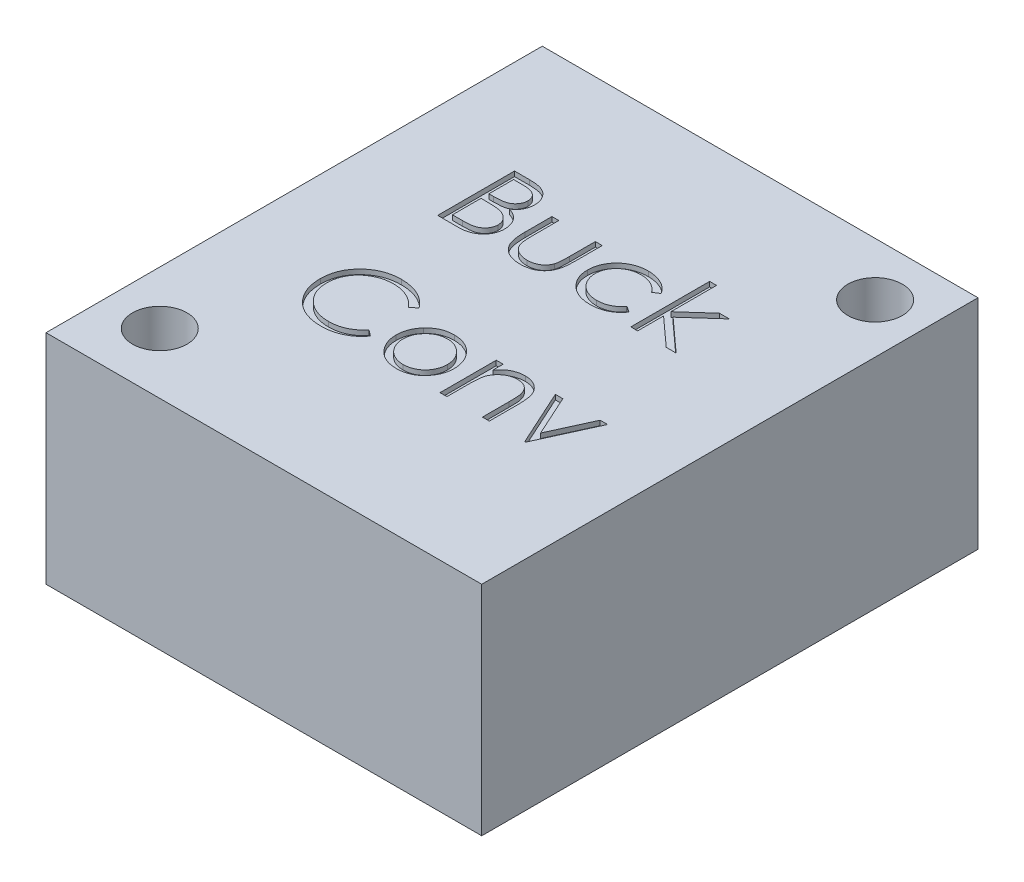
from build123d import *

# Parameters (mm, degrees)
SKETCH1_W           = 18
SKETCH1_H           = 20.5
SKETCH1_R           = 1.125
BOSS_EXTRUDE1_DEPTH = 9
CUT_EXTRUDE1_DEPTH  = 0.2


with BuildPart() as part:
    # Sketch1 → Boss-Extrude1 (new body)
    with BuildSketch(Plane(origin=(0, 0, 0), x_dir=(1, 0, 0), z_dir=(0, 1, 0))):
        Rectangle(SKETCH1_W, SKETCH1_H)
        with Locations((6.95, 8.05)):
            Circle(SKETCH1_R, mode=Mode.SUBTRACT)
        with Locations((-6.8, -7.75)):
            Circle(SKETCH1_R, mode=Mode.SUBTRACT)
    extrude(amount=BOSS_EXTRUDE1_DEPTH)

    # Sketch3 → Cut-Extrude1 (cut)
    # profile 1 of 8: a face of its own
    with BuildSketch(Plane(origin=(0, 9, 0), x_dir=(1, 0, 0), z_dir=(0, 1, 0))):
        with BuildLine():
            Line((-5.106587344, 5.210805031), (-4.487106175, 5.210805031))
            add(Edge.make_bspline(
                [(-4.487106175, 5.210805031), (-4.456781769, 5.210645601), (-4.398005525, 5.210336584), (-4.312535031, 5.20554403), (-4.232480753, 5.199009272), (-4.157819474, 5.188640545), (-4.088585694, 5.176129433), (-4.024570766, 5.1609785), (-3.965978252, 5.1428115), (-3.896025984, 5.113922374), (-3.816269385, 5.070993499), (-3.729910843, 5.007558301), (-3.656065569, 4.929968138), (-3.592396552, 4.842444586), (-3.541776965, 4.746164279), (-3.505156245, 4.643422015), (-3.481971601, 4.535543006), (-3.479587236, 4.461480981), (-3.478382216, 4.424051225)],
                knots=[0, 0, 0, 0, 1.001505555, 1.941167018, 2.826882275, 3.653841531, 4.429895133, 5.150066043, 5.825578002, 6.45369114, 7.647487171, 8.808567382, 9.977351308, 11.170798116, 12.373658725, 13.556498008, 14.765093433, 16, 16, 16, 16], degree=3))
            add(Edge.make_bspline(
                [(-3.478382216, 4.424051225), (-3.479373922, 4.388987835), (-3.481322716, 4.320084968), (-3.499957933, 4.21930674), (-3.529132254, 4.123375277), (-3.569686301, 4.032640685), (-3.622393112, 3.94915305), (-3.684857444, 3.872238887), (-3.760219972, 3.805154714), (-3.816683483, 3.767650795), (-3.845364388, 3.748600504)],
                knots=[0, 0, 0, 0, 1.044552857, 2.05264487, 3.044412934, 4.028983338, 5.005914585, 5.980388656, 6.974128949, 8, 8, 8, 8], degree=3))
            add(Edge.make_bspline(
                [(-3.845364388, 3.748600504), (-3.809296, 3.734752969), (-3.740288239, 3.708259205), (-3.645323071, 3.661418463), (-3.563503461, 3.610471405), (-3.494200336, 3.554834656), (-3.434929749, 3.49486452), (-3.383174581, 3.429681667), (-3.33901362, 3.358435793), (-3.301174039, 3.281869729), (-3.271647667, 3.20076529), (-3.24953524, 3.115883229), (-3.236864768, 3.027527918), (-3.235061694, 2.96739761), (-3.234151447, 2.93704201)],
                knots=[0, 0, 0, 0, 1.27268992, 2.434971085, 3.483601985, 4.442670788, 5.356604649, 6.2567628, 7.179492994, 8.113709626, 9.066344395, 10.018646069, 10.999752585, 12, 12, 12, 12], degree=3))
            add(Edge.make_bspline(
                [(-3.234151447, 2.93704201), (-3.235037586, 2.906047776), (-3.236781089, 2.845065753), (-3.249644349, 2.755480738), (-3.271424039, 2.669869179), (-3.301424293, 2.587677335), (-3.340578679, 2.509064213), (-3.388229046, 2.433940752), (-3.445044822, 2.363061752), (-3.508601853, 2.295639608), (-3.580503942, 2.235017258), (-3.658078948, 2.18102801), (-3.742303824, 2.136626939), (-3.831795276, 2.099328834), (-3.927557191, 2.070838018), (-4.029159557, 2.050905755), (-4.136514745, 2.037475471), (-4.21018359, 2.036371293), (-4.247963546, 2.035805031)],
                knots=[0, 0, 0, 0, 0.978564426, 1.925352924, 2.850884081, 3.763762016, 4.682927383, 5.618979971, 6.567305752, 7.547517671, 8.540179244, 9.531824382, 10.526200242, 11.540722885, 12.589160233, 13.674978461, 14.80764778, 16, 16, 16, 16], degree=3))
            Line((-4.247963546, 2.035805031), (-5.106587344, 2.035805031))
            Line((-5.106587344, 2.035805031), (-5.106587344, 5.210805031))
        make_face()
        with BuildLine():
            Line((-4.821651447, 4.885164006), (-4.821651447, 3.867535801))
            Line((-4.821651447, 3.867535801), (-4.630210141, 3.867535801))
            add(Edge.make_bspline(
                [(-4.630210141, 3.867535801), (-4.602225877, 3.867898588), (-4.548154575, 3.868599567), (-4.469850097, 3.870607543), (-4.397165259, 3.876230054), (-4.330225525, 3.881850949), (-4.269136308, 3.890990039), (-4.214032948, 3.901868608), (-4.164050649, 3.913373814), (-4.106411205, 3.93294042), (-4.041030744, 3.961858026), (-3.971332142, 4.006736048), (-3.909887302, 4.060188855), (-3.858001282, 4.12186637), (-3.815536591, 4.189780696), (-3.786042006, 4.262848223), (-3.76604197, 4.339247914), (-3.764235367, 4.391697329), (-3.763318114, 4.418327067)],
                knots=[0, 0, 0, 0, 1.156816544, 2.235205308, 3.236616184, 4.169592532, 5.011045266, 5.787822928, 6.49130361, 7.128639758, 8.301311294, 9.436451833, 10.541879658, 11.654887649, 12.756523258, 13.837046038, 14.901820046, 16, 16, 16, 16], degree=3))
            add(Edge.make_bspline(
                [(-3.763318114, 4.418327067), (-3.763795434, 4.435949016), (-3.764731751, 4.470516395), (-3.772400104, 4.520907595), (-3.785433546, 4.568300142), (-3.802174227, 4.613343514), (-3.825568251, 4.654629264), (-3.85311225, 4.693584877), (-3.886391412, 4.728883727), (-3.92427126, 4.761876058), (-3.967821939, 4.791126451), (-4.017017468, 4.816744857), (-4.072523433, 4.837373991), (-4.13340438, 4.855440786), (-4.200597438, 4.868130167), (-4.273327211, 4.878701454), (-4.35218942, 4.884083299), (-4.406749621, 4.884795735), (-4.434952729, 4.885164006)],
                knots=[0, 0, 0, 0, 0.91205012, 1.789085906, 2.630437955, 3.453916878, 4.269457761, 5.079663411, 5.91843418, 6.774407191, 7.675494373, 8.627863946, 9.638891023, 10.736472738, 11.911756761, 13.175263542, 14.539845004, 16, 16, 16, 16], degree=3))
            Line((-4.434952729, 4.885164006), (-4.821651447, 4.885164006))
        make_face(mode=Mode.SUBTRACT)
        with BuildLine():
            Line((-4.821651447, 3.541894775), (-4.821651447, 2.361446057))
            Line((-4.821651447, 2.361446057), (-4.4158722, 2.361446057))
            add(Edge.make_bspline(
                [(-4.4158722, 2.361446057), (-4.38682646, 2.361794171), (-4.330844626, 2.362465114), (-4.250017081, 2.36465546), (-4.175102409, 2.369637739), (-4.106442457, 2.377480759), (-4.043295832, 2.385988352), (-3.986420058, 2.397428586), (-3.93535409, 2.410535857), (-3.876140968, 2.430796142), (-3.809462786, 2.462270798), (-3.737607223, 2.509727275), (-3.673720582, 2.566263418), (-3.619468669, 2.631696462), (-3.575006886, 2.70284488), (-3.542662295, 2.77826959), (-3.522713446, 2.856724318), (-3.520298478, 2.910215551), (-3.519087344, 2.93704201)],
                knots=[0, 0, 0, 0, 1.160039823, 2.235823828, 3.228722157, 4.157150951, 4.99529583, 5.772374946, 6.472645482, 7.099169577, 8.269452708, 9.405989375, 10.527446681, 11.663510218, 12.788923519, 13.866172445, 14.929861265, 16, 16, 16, 16], degree=3))
            add(Edge.make_bspline(
                [(-3.519087344, 2.93704201), (-3.519337811, 2.953818112), (-3.519834703, 2.987099716), (-3.52732826, 3.036009066), (-3.538226557, 3.083385394), (-3.552315786, 3.129357344), (-3.572834874, 3.173093764), (-3.596789383, 3.215459657), (-3.624875797, 3.256511028), (-3.668640147, 3.308410715), (-3.732296162, 3.368206863), (-3.822744451, 3.426751597), (-3.925589321, 3.473966393), (-4.000181404, 3.494013775), (-4.038713747, 3.504369735)],
                knots=[0, 0, 0, 0, 0.723448775, 1.435228256, 2.130040452, 2.821711965, 3.505591119, 4.210454504, 4.921174351, 5.648778258, 7.137944449, 8.670945889, 10.280296675, 12, 12, 12, 12], degree=3))
            add(Edge.make_bspline(
                [(-4.038713747, 3.504369735), (-4.054161569, 3.50750399), (-4.087655635, 3.5142997), (-4.142272512, 3.521473117), (-4.204625764, 3.527863993), (-4.274859374, 3.532591257), (-4.353062202, 3.537477622), (-4.439401264, 3.539377924), (-4.53352397, 3.54164511), (-4.598831337, 3.541809424), (-4.632754211, 3.541894775)],
                knots=[0, 0, 0, 0, 0.634451884, 1.375622551, 2.216452059, 3.157844607, 4.20941857, 5.370758133, 6.634282058, 8, 8, 8, 8], degree=3))
            Line((-4.632754211, 3.541894775), (-4.821651447, 3.541894775))
        make_face(mode=Mode.SUBTRACT)
    # profile 2 of 8: a face of its own
    with BuildSketch(Plane(origin=(0, 9, 0), x_dir=(1, 0, 0), z_dir=(0, 1, 0))):
        with BuildLine():
            Line((-2.70498478, 4.355997339), (-2.420048883, 4.355997339))
            Line((-2.420048883, 4.355997339), (-2.420048883, 3.279855512))
            add(Edge.make_bspline(
                [(-2.420048883, 3.279855512), (-2.419920155, 3.248266304), (-2.419673904, 3.187837628), (-2.418003908, 3.10088328), (-2.414075894, 3.021583834), (-2.409164782, 2.94989348), (-2.40284913, 2.885824346), (-2.395334939, 2.829600215), (-2.386936228, 2.780583491), (-2.378715051, 2.751062018), (-2.374891631, 2.737332475)],
                knots=[0, 0, 0, 0, 1.388932606, 2.656963016, 3.823490214, 4.879454478, 5.816252168, 6.653371382, 7.373723809, 8, 8, 8, 8], degree=3))
            add(Edge.make_bspline(
                [(-2.374891631, 2.737332475), (-2.368758026, 2.720076014), (-2.356618331, 2.685921848), (-2.334598813, 2.636583251), (-2.307358822, 2.590885673), (-2.277550264, 2.547066979), (-2.243170087, 2.506425176), (-2.204653281, 2.469028898), (-2.163289166, 2.433465187), (-2.101825681, 2.391387554), (-2.017770489, 2.346288647), (-1.907414061, 2.307376012), (-1.787758085, 2.284120661), (-1.705058661, 2.281422587), (-1.662551888, 2.280035801)],
                knots=[0, 0, 0, 0, 0.725840625, 1.436591201, 2.137033971, 2.831655856, 3.53531722, 4.242432219, 4.957935707, 5.694543706, 7.190802206, 8.724350549, 10.316345118, 12, 12, 12, 12], degree=3))
            add(Edge.make_bspline(
                [(-1.662551888, 2.280035801), (-1.620049063, 2.281452076), (-1.537813961, 2.284192307), (-1.419472667, 2.306674517), (-1.311294599, 2.344235392), (-1.214365521, 2.396674973), (-1.129125081, 2.46084813), (-1.058091786, 2.536148978), (-0.999483777, 2.620195207), (-0.973893802, 2.682900803), (-0.961024444, 2.714435841)],
                knots=[0, 0, 0, 0, 1.157059328, 2.238695713, 3.266970494, 4.264342957, 5.228770407, 6.160125903, 7.074715775, 8, 8, 8, 8], degree=3))
            add(Edge.make_bspline(
                [(-0.961024444, 2.714435841), (-0.957219678, 2.727105269), (-0.94880827, 2.75511428), (-0.939770994, 2.802630195), (-0.931629875, 2.859294514), (-0.92467828, 2.925478032), (-0.919720596, 3.001007792), (-0.917048129, 3.08586019), (-0.914028908, 3.179768852), (-0.913983083, 3.245507462), (-0.913959139, 3.279855512)],
                knots=[0, 0, 0, 0, 0.557542046, 1.232589297, 2.036731608, 2.971723315, 4.038036528, 5.22795436, 6.551621927, 8, 8, 8, 8], degree=3))
            Line((-0.913959139, 3.279855512), (-0.913959139, 4.355997339))
            Line((-0.913959139, 4.355997339), (-0.629023242, 4.355997339))
            Line((-0.629023242, 4.355997339), (-0.629023242, 3.226430031))
            add(Edge.make_bspline(
                [(-0.629023242, 3.226430031), (-0.629423922, 3.188051383), (-0.630201297, 3.113591555), (-0.635197244, 3.005383825), (-0.643769393, 2.904543789), (-0.656780257, 2.811018068), (-0.672079833, 2.724878067), (-0.691815881, 2.646013384), (-0.715381854, 2.574667003), (-0.741966142, 2.509586962), (-0.773373122, 2.450580137), (-0.806780491, 2.394576932), (-0.845356534, 2.342966912), (-0.885969532, 2.293180973), (-0.931146748, 2.247695445), (-0.98004162, 2.205466606), (-1.031965951, 2.165848927), (-1.088072009, 2.130387552), (-1.147540724, 2.098441024), (-1.210445508, 2.070123582), (-1.277556842, 2.047714815), (-1.348008856, 2.028382997), (-1.42214672, 2.013220586), (-1.499898962, 2.002528486), (-1.581239393, 1.995974079), (-1.636674402, 1.995396188), (-1.665095958, 1.995099903)],
                knots=[0, 0, 0, 0, 1.493040784, 2.896703357, 4.213163133, 5.428574705, 6.569057535, 7.615249723, 8.588095153, 9.490268104, 10.346124644, 11.18633936, 12.024365274, 12.850166724, 13.684164916, 14.514361689, 15.362232829, 16.222528818, 17.093394965, 17.986930858, 18.902426812, 19.842810585, 20.827885679, 21.843828298, 22.894529745, 24, 24, 24, 24], degree=3))
            add(Edge.make_bspline(
                [(-1.665095958, 1.995099903), (-1.693304939, 1.995408066), (-1.748738212, 1.996013635), (-1.830082841, 2.002492275), (-1.908050505, 2.013203972), (-1.982364009, 2.028494062), (-2.053097927, 2.047579504), (-2.120538773, 2.070261283), (-2.183896862, 2.09845572), (-2.243933395, 2.130185361), (-2.300178418, 2.166076718), (-2.3528912, 2.205417726), (-2.402001059, 2.248149654), (-2.447518828, 2.294094043), (-2.488805599, 2.343820835), (-2.526375866, 2.396930022), (-2.56080802, 2.452895374), (-2.591970908, 2.5128241), (-2.618742286, 2.57865728), (-2.642378116, 2.651498218), (-2.66170991, 2.732145501), (-2.677442006, 2.820530179), (-2.690097956, 2.916229252), (-2.69888467, 3.019796315), (-2.703797603, 3.130979093), (-2.704580523, 3.207768636), (-2.70498478, 3.247418613)],
                knots=[0, 0, 0, 0, 1.083640291, 2.129454052, 3.13281866, 4.105697902, 5.042300162, 5.946461698, 6.836384745, 7.703652036, 8.553297018, 9.397182691, 10.228592656, 11.052265423, 11.879314572, 12.708807002, 13.549817954, 14.402308542, 15.300838682, 16.27712199, 17.341985831, 18.484375296, 19.725102775, 21.0496083, 22.476576903, 24, 24, 24, 24], degree=3))
            Line((-2.70498478, 3.247418613), (-2.70498478, 4.355997339))
        make_face()
    # profile 3 of 8: a face of its own
    with BuildSketch(Plane(origin=(0, 9, 0), x_dir=(1, 0, 0), z_dir=(0, 1, 0))):
        with BuildLine():
            Line((2.301745989, 3.852907395), (2.063239378, 3.704715288))
            add(Edge.make_bspline(
                [(2.063239378, 3.704715288), (2.037086572, 3.737216759), (1.985609213, 3.801190388), (1.896220048, 3.883749399), (1.800959694, 3.954658072), (1.698200322, 4.012446475), (1.588086061, 4.057097362), (1.47105116, 4.088693334), (1.347112309, 4.108382183), (1.262144593, 4.110619957), (1.218607968, 4.11176657)],
                knots=[0, 0, 0, 0, 1.026593902, 2.0206758, 2.988051866, 3.946915611, 4.916868779, 5.907761954, 6.927957743, 8, 8, 8, 8], degree=3))
            add(Edge.make_bspline(
                [(1.218607968, 4.11176657), (1.183810914, 4.110807863), (1.115279063, 4.108919716), (1.014671338, 4.09711734), (0.918838632, 4.075670661), (0.827180275, 4.047412293), (0.740348181, 4.009538816), (0.658114848, 3.963447108), (0.579750867, 3.909880286), (0.507527109, 3.847822148), (0.441460796, 3.780331928), (0.384221066, 3.707983933), (0.33438542, 3.632945175), (0.295282159, 3.553341809), (0.263282541, 3.47099496), (0.24223073, 3.384350248), (0.228202042, 3.294517699), (0.226597008, 3.233268919), (0.22578445, 3.202261361)],
                knots=[0, 0, 0, 0, 1.112346261, 2.190735716, 3.231507886, 4.247384806, 5.251966152, 6.253067467, 7.256802811, 8.280671706, 9.291813951, 10.270744147, 11.225547591, 12.165006084, 13.100104208, 14.043489273, 15.009504848, 16, 16, 16, 16], degree=3))
            add(Edge.make_bspline(
                [(0.22578445, 3.202261361), (0.227398486, 3.161649291), (0.23060481, 3.080972364), (0.255733992, 2.961884372), (0.296867847, 2.846746452), (0.353163183, 2.736376071), (0.424353155, 2.634237087), (0.507966837, 2.542630668), (0.604050577, 2.463331842), (0.711757763, 2.397588909), (0.82855943, 2.344737525), (0.953191882, 2.307084445), (1.084636683, 2.284358364), (1.174631375, 2.281495473), (1.220516021, 2.280035801)],
                knots=[0, 0, 0, 0, 0.966302908, 1.919585723, 2.883856336, 3.870342332, 4.860282998, 5.839159637, 6.814385684, 7.815993281, 8.834850808, 9.858348828, 10.908058873, 12, 12, 12, 12], degree=3))
            add(Edge.make_bspline(
                [(1.220516021, 2.280035801), (1.262566795, 2.28121463), (1.345207726, 2.283531343), (1.466009477, 2.303061188), (1.581016968, 2.335032199), (1.69022611, 2.379616139), (1.793437346, 2.437244671), (1.889983812, 2.508327633), (1.981786613, 2.59082012), (2.035758871, 2.654608566), (2.063239378, 2.687087083)],
                knots=[0, 0, 0, 0, 1.039848629, 2.043578496, 3.018386758, 3.987534228, 4.954977003, 5.934852016, 6.948509513, 8, 8, 8, 8], degree=3))
            Line((2.063239378, 2.687087083), (2.301745989, 2.530626746))
            add(Edge.make_bspline(
                [(2.301745989, 2.530626746), (2.287605716, 2.509861587), (2.259372104, 2.46840019), (2.212175615, 2.40994017), (2.161266911, 2.355219787), (2.106844601, 2.30431239), (2.0496193, 2.255999758), (1.987636125, 2.212591544), (1.922893691, 2.171647812), (1.854631955, 2.134806135), (1.783556679, 2.101689686), (1.709767874, 2.07321341), (1.633586187, 2.048747671), (1.554922046, 2.029300935), (1.473620367, 2.01377896), (1.389891413, 2.003479531), (1.303764021, 1.99579124), (1.245550712, 1.995332347), (1.216063898, 1.995099903)],
                knots=[0, 0, 0, 0, 0.954134338, 1.905101784, 2.851144739, 3.791306361, 4.734911809, 5.6936923, 6.663572882, 7.643865596, 8.638447847, 9.640600242, 10.646758161, 11.676244097, 12.717260333, 13.78922464, 14.880174919, 16, 16, 16, 16], degree=3))
            add(Edge.make_bspline(
                [(1.216063898, 1.995099903), (1.171059739, 1.995908421), (1.082851261, 1.997493123), (0.953744415, 2.014917954), (0.830360588, 2.041186649), (0.712741935, 2.078890893), (0.600870144, 2.127427368), (0.494849529, 2.186715426), (0.395031141, 2.257247407), (0.302402074, 2.337767919), (0.217328905, 2.425071929), (0.144280147, 2.51927864), (0.080920508, 2.616924448), (0.030041094, 2.720165947), (-0.010460046, 2.827630963), (-0.038132287, 2.940180395), (-0.056029978, 3.056886368), (-0.058101329, 3.136472626), (-0.059151447, 3.176820656)],
                knots=[0, 0, 0, 0, 1.1129367, 2.181364009, 3.217532258, 4.231199276, 5.232079859, 6.230262199, 7.231623845, 8.250719726, 9.263571943, 10.242672461, 11.195837495, 12.138959767, 13.085126421, 14.0317438, 15.002148558, 16, 16, 16, 16], degree=3))
            add(Edge.make_bspline(
                [(-0.059151447, 3.176820656), (-0.058751382, 3.204196808), (-0.057955588, 3.258652491), (-0.048827982, 3.339474445), (-0.03703651, 3.419220054), (-0.01705602, 3.496878485), (0.006022267, 3.573627569), (0.035482214, 3.64854224), (0.070040179, 3.721970621), (0.109275874, 3.793723562), (0.153443522, 3.862620644), (0.202321498, 3.927711468), (0.25406886, 3.98977797), (0.311106476, 4.046677381), (0.371013876, 4.100685212), (0.435485948, 4.150358654), (0.504152899, 4.195843695), (0.575983485, 4.237981402), (0.650935902, 4.275500318), (0.728557095, 4.307824756), (0.808379343, 4.335449592), (0.890530331, 4.357319826), (0.974464788, 4.375659917), (1.060844145, 4.387196821), (1.149337947, 4.395348654), (1.209260196, 4.396247444), (1.23959655, 4.396702467)],
                knots=[0, 0, 0, 0, 0.990994727, 1.971252077, 2.943264845, 3.907940874, 4.872158414, 5.844625996, 6.82015047, 7.809835459, 8.804511986, 9.781214284, 10.756496977, 11.728388426, 12.696359165, 13.676225489, 14.672885716, 15.677705647, 16.690706858, 17.706033469, 18.721040654, 19.747369689, 20.783475414, 21.830280724, 22.901553713, 24, 24, 24, 24], degree=3))
            add(Edge.make_bspline(
                [(1.23959655, 4.396702467), (1.277587791, 4.39586618), (1.353380374, 4.394197787), (1.465812301, 4.380156438), (1.576588227, 4.358986974), (1.683764528, 4.327624479), (1.786041723, 4.289648163), (1.881777453, 4.247000915), (1.968718119, 4.19747581), (2.048481003, 4.143301135), (2.12121528, 4.08219517), (2.187667569, 4.01342743), (2.249200565, 3.93735581), (2.284086296, 3.881289182), (2.301745989, 3.852907395)],
                knots=[0, 0, 0, 0, 1.095225653, 2.184976855, 3.262915854, 4.344593502, 5.400796181, 6.407717688, 7.363229445, 8.282371371, 9.184954523, 10.097238608, 11.036792983, 12, 12, 12, 12], degree=3))
        make_face()
    # profile 4 of 8: a face of its own
    with BuildSketch(Plane(origin=(0, 9, 0), x_dir=(1, 0, 0), z_dir=(0, 1, 0))):
        Polygon((2.871617784, 5.292215288), (3.156553681, 5.292215288), (3.156553681, 3.409603108), (4.212342944, 4.355997339), (4.621938297, 4.355997339), (3.396968345, 3.256958877), (4.744053681, 2.035805031), (4.335094346, 2.035805031), (3.156553681, 3.104950664), (3.156553681, 2.035805031), (2.871617784, 2.035805031), align=None)
    # profile 5 of 8: a face of its own
    with BuildSketch(Plane(origin=(0, 9, 0), x_dir=(1, 0, 0), z_dir=(0, 1, 0))):
        with BuildLine():
            Line((-2.175818114, -1.663453783), (-2.425137024, -1.854259071))
            add(Edge.make_bspline(
                [(-2.425137024, -1.854259071), (-2.442922366, -1.833062799), (-2.478253264, -1.790956025), (-2.535094112, -1.731828867), (-2.594332031, -1.676433951), (-2.655944376, -1.624507389), (-2.721040149, -1.577865037), (-2.788042445, -1.534076251), (-2.8580721, -1.494826231), (-2.954911174, -1.447234808), (-3.081591722, -1.397572225), (-3.241062754, -1.355931436), (-3.407533537, -1.329423656), (-3.521105645, -1.326552692), (-3.578873002, -1.325092405)],
                knots=[0, 0, 0, 0, 0.757959112, 1.505699292, 2.245454638, 2.979532153, 3.711538275, 4.438200793, 5.171680507, 5.909471876, 7.393775596, 8.890124382, 10.418191784, 12, 12, 12, 12], degree=3))
            add(Edge.make_bspline(
                [(-3.578873002, -1.325092405), (-3.610698566, -1.325458856), (-3.674054323, -1.326188359), (-3.768078296, -1.335812351), (-3.860346564, -1.349338949), (-3.950799108, -1.369409777), (-4.039320792, -1.394784939), (-4.126490328, -1.425106565), (-4.211045658, -1.462621312), (-4.294156488, -1.504085234), (-4.373784772, -1.550918701), (-4.449127566, -1.602002956), (-4.51991008, -1.656766351), (-4.586188306, -1.71541414), (-4.648030002, -1.777682204), (-4.704987063, -1.844234143), (-4.756862399, -1.914857186), (-4.804684272, -1.988620063), (-4.847512966, -2.065307917), (-4.883372214, -2.145204588), (-4.91512686, -2.226941881), (-4.94025403, -2.311443291), (-4.960142699, -2.398114229), (-4.973865651, -2.487187301), (-4.983380192, -2.578476425), (-4.984106067, -2.640352015), (-4.98447196, -2.671541723)],
                knots=[0, 0, 0, 0, 1.054917814, 2.100044995, 3.131103042, 4.146048494, 5.169673617, 6.183595914, 7.203665975, 8.234915748, 9.262203917, 10.264457458, 11.251630812, 12.227803204, 13.197192746, 14.159520551, 15.12972552, 16.100847026, 17.073214652, 18.039054194, 19.002613845, 19.979014051, 20.95965708, 21.949030935, 22.966165397, 24, 24, 24, 24], degree=3))
            add(Edge.make_bspline(
                [(-4.98447196, -2.671541723), (-4.98332731, -2.718469421), (-4.981079941, -2.81060573), (-4.961078952, -2.945561927), (-4.930685048, -3.074848538), (-4.885132346, -3.197657395), (-4.828962922, -3.315502834), (-4.75798751, -3.426390937), (-4.675785365, -3.531997392), (-4.58119357, -3.629826351), (-4.477411152, -3.719192374), (-4.36606126, -3.797887544), (-4.247421228, -3.863487473), (-4.122800999, -3.918075653), (-3.991241596, -3.960037113), (-3.852979596, -3.989577425), (-3.708315715, -4.008847118), (-3.609464902, -4.010691963), (-3.559156455, -4.011630866)],
                knots=[0, 0, 0, 0, 1.029171465, 2.020641659, 2.987623507, 3.938342917, 4.889210282, 5.84687017, 6.821220943, 7.821438502, 8.827599549, 9.822697543, 10.807740252, 11.797342354, 12.80366471, 13.83203677, 14.896651826, 16, 16, 16, 16], degree=3))
            add(Edge.make_bspline(
                [(-3.559156455, -4.011630866), (-3.503727587, -4.010098902), (-3.394630315, -4.007083629), (-3.23463932, -3.981539167), (-3.081481161, -3.940120913), (-2.935147601, -3.882156369), (-2.796051172, -3.806804287), (-2.663974201, -3.715456927), (-2.538805205, -3.607245368), (-2.463538399, -3.524619958), (-2.425137024, -3.482464199)],
                knots=[0, 0, 0, 0, 1.028121516, 2.023589091, 2.998037872, 3.967518031, 4.937445131, 5.927275754, 6.942489185, 8, 8, 8, 8], degree=3))
            Line((-2.425137024, -3.482464199), (-2.175818114, -3.671361435))
            add(Edge.make_bspline(
                [(-2.175818114, -3.671361435), (-2.195882399, -3.697249888), (-2.235914863, -3.748902789), (-2.300737493, -3.821720697), (-2.369024755, -3.890213644), (-2.441283864, -3.953829415), (-2.516683575, -4.013840965), (-2.596577744, -4.068543341), (-2.67991608, -4.118700072), (-2.766416215, -4.164625925), (-2.855986242, -4.205372284), (-2.948518837, -4.240255345), (-3.043615144, -4.270304352), (-3.141279513, -4.295025752), (-3.241714521, -4.314321664), (-3.344557737, -4.32722094), (-3.450031123, -4.336058248), (-3.521188698, -4.336863715), (-3.557248402, -4.337271892)],
                knots=[0, 0, 0, 0, 0.986787822, 1.968848986, 2.935600012, 3.899624008, 4.868462664, 5.837806735, 6.815139263, 7.798259679, 8.787526145, 9.778297419, 10.776456485, 11.791383307, 12.812564526, 13.85620153, 14.913611965, 16, 16, 16, 16], degree=3))
            add(Edge.make_bspline(
                [(-3.557248402, -4.337271892), (-3.591396586, -4.337034227), (-3.65892039, -4.336564275), (-3.758614258, -4.32895138), (-3.855669092, -4.318564833), (-3.949807503, -4.302925571), (-4.041543209, -4.284470348), (-4.130044596, -4.259731423), (-4.216182537, -4.232018964), (-4.29961096, -4.199448012), (-4.380400831, -4.162694047), (-4.458291574, -4.121154561), (-4.533247366, -4.075178869), (-4.606005141, -4.025780396), (-4.675490092, -3.971372415), (-4.742304361, -3.912710539), (-4.806822607, -3.849992487), (-4.846739329, -3.804767012), (-4.866808699, -3.782028502)],
                knots=[0, 0, 0, 0, 1.114604814, 2.203992996, 3.262667896, 4.300477797, 5.318619304, 6.316056647, 7.298880507, 8.271930387, 9.238335007, 10.195173496, 11.151986948, 12.108099108, 13.064862484, 14.031167946, 15.010108607, 16, 16, 16, 16], degree=3))
            add(Edge.make_bspline(
                [(-4.866808699, -3.782028502), (-4.89895389, -3.742530424), (-4.962856186, -3.664011122), (-5.044613056, -3.536751696), (-5.11459691, -3.403884107), (-5.171180781, -3.264710314), (-5.215415546, -3.119542613), (-5.246059916, -2.968307825), (-5.265973157, -2.811147192), (-5.268250348, -2.704252391), (-5.269407857, -2.649917124)],
                knots=[0, 0, 0, 0, 0.994628077, 1.977248131, 2.950237994, 3.925870899, 4.908910175, 5.911660606, 6.938484602, 8, 8, 8, 8], degree=3))
            add(Edge.make_bspline(
                [(-5.269407857, -2.649917124), (-5.267997075, -2.592807534), (-5.265221448, -2.480447981), (-5.241639547, -2.315553038), (-5.203703925, -2.15757284), (-5.149822462, -2.006802301), (-5.08150975, -1.862448403), (-4.997121322, -1.725613882), (-4.897637557, -1.595423642), (-4.783838692, -1.473853118), (-4.659045467, -1.362692419), (-4.525406257, -1.264896792), (-4.383182634, -1.183510188), (-4.23394144, -1.115477955), (-4.076565143, -1.063186192), (-3.911389515, -1.026580087), (-3.738724928, -1.003795274), (-3.620921156, -1.000914907), (-3.561064508, -0.999451379)],
                knots=[0, 0, 0, 0, 1.032925535, 2.032216505, 3.007276963, 3.968222605, 4.92396291, 5.891752235, 6.871517503, 7.883894988, 8.900124299, 9.891468569, 10.874487609, 11.85992873, 12.854644235, 13.869047385, 14.917252991, 16, 16, 16, 16], degree=3))
            add(Edge.make_bspline(
                [(-3.561064508, -0.999451379), (-3.524584237, -0.999888747), (-3.452375214, -1.000754473), (-3.345556737, -1.009196474), (-3.241559769, -1.023269531), (-3.140312664, -1.042424823), (-3.041322862, -1.066198607), (-2.945346929, -1.097168735), (-2.851821692, -1.132580446), (-2.761336996, -1.173364197), (-2.674326983, -1.219144741), (-2.590818751, -1.269414628), (-2.511475629, -1.324111537), (-2.435739317, -1.382770275), (-2.364876754, -1.446631825), (-2.296875984, -1.513939644), (-2.234046292, -1.58663247), (-2.195263036, -1.637799803), (-2.175818114, -1.663453783)],
                knots=[0, 0, 0, 0, 1.096760587, 2.17092713, 3.219439832, 4.250915756, 5.268269357, 6.278326846, 7.281116186, 8.274029601, 9.260640565, 10.235837813, 11.203064059, 12.156899882, 13.114053108, 14.069676657, 15.032185724, 16, 16, 16, 16], degree=3))
        make_face()
    # profile 6 of 8: a face of its own
    with BuildSketch(Plane(origin=(0, 9, 0), x_dir=(1, 0, 0), z_dir=(0, 1, 0))):
        with BuildLine():
            add(Edge.make_bspline(
                [(-0.485283258, -1.894964199), (-0.441748318, -1.895891201), (-0.356386939, -1.897708824), (-0.2313755, -1.917135257), (-0.112045269, -1.946841794), (0.002060777, -1.987909569), (0.109481273, -2.042956767), (0.211780902, -2.108642338), (0.308679188, -2.186459405), (0.366757222, -2.246655653), (0.396237175, -2.277210794)],
                knots=[0, 0, 0, 0, 1.054011418, 2.066658804, 3.057071809, 4.030435133, 4.997543892, 5.974964718, 6.972108034, 8, 8, 8, 8], degree=3))
            add(Edge.make_bspline(
                [(0.396237175, -2.277210794), (0.421620805, -2.306433481), (0.471896821, -2.364313316), (0.53636358, -2.458162336), (0.591900281, -2.555353713), (0.636407396, -2.657178074), (0.671500239, -2.762746525), (0.696415549, -2.872421921), (0.711235483, -2.98596205), (0.713233888, -3.063072675), (0.714245989, -3.102125658)],
                knots=[0, 0, 0, 0, 1.025258237, 2.030674902, 3.01204498, 3.988269485, 4.97094183, 5.956517959, 6.965070386, 8, 8, 8, 8], degree=3))
            add(Edge.make_bspline(
                [(0.714245989, -3.102125658), (0.713355776, -3.141404996), (0.711596673, -3.2190228), (0.694956392, -3.333340367), (0.669074622, -3.444188528), (0.632034311, -3.5511032), (0.584538027, -3.654411193), (0.526580046, -3.753661284), (0.45775365, -3.849049291), (0.379735739, -3.939765244), (0.293510108, -4.023373168), (0.199969031, -4.096242384), (0.100950729, -4.158673338), (-0.004861456, -4.208962086), (-0.116501248, -4.248613029), (-0.234209445, -4.276462329), (-0.357803187, -4.293300428), (-0.442192167, -4.29546267), (-0.485283258, -4.296566764)],
                knots=[0, 0, 0, 0, 0.998656419, 1.973391657, 2.932242238, 3.890759089, 4.846373663, 5.82037756, 6.809684879, 7.83454468, 8.860553229, 9.859544525, 10.845671541, 11.83227036, 12.833544569, 13.85385346, 14.904124723, 16, 16, 16, 16], degree=3))
            add(Edge.make_bspline(
                [(-0.485283258, -4.296566764), (-0.528585468, -4.295458964), (-0.613395033, -4.293289283), (-0.737425031, -4.276527748), (-0.855344186, -4.248625864), (-0.967130129, -4.208831781), (-1.07339724, -4.158671731), (-1.172989276, -4.096431127), (-1.266606342, -4.023351557), (-1.352850214, -3.9397711), (-1.430863235, -3.849047782), (-1.499690892, -3.753661676), (-1.557648545, -3.654411091), (-1.605144916, -3.551103227), (-1.642185203, -3.44418852), (-1.66806698, -3.333340369), (-1.684707259, -3.219022799), (-1.686466362, -3.141404996), (-1.687356575, -3.102125658)],
                knots=[0, 0, 0, 0, 1.099876186, 2.154163076, 3.173186993, 4.173200201, 5.163417411, 6.152872554, 7.150605724, 8.17532212, 9.198891216, 10.186952605, 11.159729845, 12.11414092, 13.071450619, 14.029093627, 15.002601286, 16, 16, 16, 16], degree=3))
            add(Edge.make_bspline(
                [(-1.687356575, -3.102125658), (-1.686337572, -3.063284934), (-1.684320122, -2.986386976), (-1.669515088, -2.873060285), (-1.644696969, -2.763570511), (-1.60956206, -2.658409544), (-1.564644708, -2.557031398), (-1.509888397, -2.459599873), (-1.444764037, -2.366175225), (-1.394687981, -2.308370195), (-1.369347761, -2.279118847)],
                knots=[0, 0, 0, 0, 1.031353054, 2.041901799, 3.029428768, 4.008703097, 4.981709435, 5.96992636, 6.972712378, 8, 8, 8, 8], degree=3))
            add(Edge.make_bspline(
                [(-1.369347761, -2.279118847), (-1.339912254, -2.248298723), (-1.282022148, -2.187685528), (-1.184641517, -2.110095309), (-1.082593551, -2.043042871), (-0.973985939, -1.989089447), (-0.859973632, -1.94660022), (-0.740031891, -1.917058646), (-0.614596245, -1.897778816), (-0.52881716, -1.895911755), (-0.485283258, -1.894964199)],
                knots=[0, 0, 0, 0, 1.027980169, 2.021703884, 2.998553061, 3.971491411, 4.943284454, 5.930300938, 6.949603206, 8, 8, 8, 8], degree=3))
        make_face()
        with BuildLine():
            add(Edge.make_bspline(
                [(-0.486555293, -2.179900097), (-0.517341555, -2.180775119), (-0.578119336, -2.182502576), (-0.667581388, -2.195641546), (-0.75370567, -2.216458211), (-0.836655579, -2.246034748), (-0.916151385, -2.284224463), (-0.9922692, -2.331131333), (-1.065232914, -2.386134086), (-1.133615214, -2.449146652), (-1.196373454, -2.51797974), (-1.251235619, -2.591320752), (-1.297885537, -2.66798008), (-1.336747681, -2.748037443), (-1.365692059, -2.832304133), (-1.3867133, -2.919825848), (-1.399839876, -3.010780904), (-1.401551091, -3.072612685), (-1.402420678, -3.104033711)],
                knots=[0, 0, 0, 0, 1.021534396, 2.016698045, 2.994645724, 3.958388632, 4.93408049, 5.916473867, 6.921342795, 7.962252576, 8.998418191, 10.008913653, 10.997312074, 11.973003931, 12.956656626, 13.948281152, 14.957379055, 16, 16, 16, 16], degree=3))
            add(Edge.make_bspline(
                [(-1.402420678, -3.104033711), (-1.400963059, -3.144630192), (-1.398069959, -3.225206617), (-1.374542994, -3.343870993), (-1.335185441, -3.457791673), (-1.282038408, -3.566300823), (-1.215448481, -3.66669639), (-1.136992356, -3.756205522), (-1.047512057, -3.833481222), (-0.948074232, -3.897598847), (-0.840709958, -3.948543768), (-0.727084581, -3.984647124), (-0.608574808, -4.008116445), (-0.527584431, -4.01044914), (-0.486555293, -4.011630866)],
                knots=[0, 0, 0, 0, 1.016792936, 2.018143844, 3.017858371, 4.030088057, 5.03801393, 6.028138512, 7.003788237, 7.991172063, 8.984598303, 9.972568034, 10.972917682, 12, 12, 12, 12], degree=3))
            add(Edge.make_bspline(
                [(-0.486555293, -4.011630866), (-0.445528516, -4.010442255), (-0.364542796, -4.008095969), (-0.246197686, -3.984765325), (-0.132882869, -3.948385576), (-0.02563011, -3.897656143), (0.073762452, -3.833237738), (0.163886297, -3.756641881), (0.241672538, -3.666459316), (0.308196593, -3.566167844), (0.362213996, -3.457959896), (0.401387329, -3.343849967), (0.424970853, -3.225211972), (0.427856319, -3.144631986), (0.429310091, -3.104033711)],
                knots=[0, 0, 0, 0, 1.02726834, 2.027799167, 3.010890988, 4.004497153, 4.992059811, 5.971914811, 6.958719428, 7.966827853, 8.981595046, 9.981490638, 10.983022906, 12, 12, 12, 12], degree=3))
            add(Edge.make_bspline(
                [(0.429310091, -3.104033711), (0.428440804, -3.072612498), (0.426730178, -3.010780347), (0.413599317, -2.919827979), (0.392593935, -2.832296316), (0.363591111, -2.748066284), (0.324897827, -2.667772798), (0.277348307, -2.591545832), (0.222710163, -2.517725679), (0.159194632, -2.449369162), (0.09088371, -2.386109522), (0.017890426, -2.331110004), (-0.058114519, -2.284430614), (-0.137379376, -2.245708096), (-0.22033992, -2.216727294), (-0.30634353, -2.19552135), (-0.395423879, -2.1825581), (-0.455983868, -2.180791765), (-0.486555293, -2.179900097)],
                knots=[0, 0, 0, 0, 1.042956736, 2.052379634, 3.044323526, 4.02829302, 5.004299113, 5.996692471, 7.007513377, 8.048758398, 9.090003419, 10.095195979, 11.07790575, 12.047570684, 13.018257071, 13.989683339, 14.985167495, 16, 16, 16, 16], degree=3))
        make_face(mode=Mode.SUBTRACT)
    # profile 7 of 8: a face of its own
    with BuildSketch(Plane(origin=(0, 9, 0), x_dir=(1, 0, 0), z_dir=(0, 1, 0))):
        with BuildLine():
            Line((1.284117784, -1.935669328), (1.569053681, -1.935669328))
            Line((1.569053681, -1.935669328), (1.569053681, -2.354168927))
            add(Edge.make_bspline(
                [(1.569053681, -2.354168927), (1.599477107, -2.3162116), (1.658514827, -2.242554082), (1.756834901, -2.145743275), (1.860742582, -2.065964393), (1.969601542, -2.002370237), (2.083559559, -1.954430797), (2.201921989, -1.919808845), (2.325397473, -1.899049037), (2.40936664, -1.896336471), (2.451846149, -1.894964199)],
                knots=[0, 0, 0, 0, 1.12780773, 2.188550248, 3.19190651, 4.159438251, 5.104880172, 6.052711206, 7.014878035, 8, 8, 8, 8], degree=3))
            add(Edge.make_bspline(
                [(2.451846149, -1.894964199), (2.494781796, -1.896547341), (2.578817213, -1.899645931), (2.701170883, -1.924153929), (2.815446747, -1.966014268), (2.921237344, -2.023356646), (3.016602745, -2.094663947), (3.100354575, -2.177738078), (3.169626949, -2.273292953), (3.216070271, -2.361941816), (3.246664251, -2.440580937), (3.265925015, -2.507933346), (3.282281691, -2.582970526), (3.296461919, -2.665465724), (3.306056871, -2.75599694), (3.313624521, -2.85419306), (3.319048051, -2.960022279), (3.319263231, -3.033216577), (3.319374194, -3.070960794)],
                knots=[0, 0, 0, 0, 1.235846778, 2.418850247, 3.575807741, 4.728682307, 5.871620074, 6.994088408, 8.11269785, 9.256955736, 9.865816715, 10.540099792, 11.271859618, 12.076849838, 12.949306005, 13.892391288, 14.913166135, 16, 16, 16, 16], degree=3))
            Line((3.319374194, -3.070960794), (3.319374194, -4.255861635))
            Line((3.319374194, -4.255861635), (3.034438297, -4.255861635))
            Line((3.034438297, -4.255861635), (3.034438297, -3.164455385))
            add(Edge.make_bspline(
                [(3.034438297, -3.164455385), (3.034263029, -3.132866453), (3.033927773, -3.072442202), (3.032870365, -2.985928874), (3.030321469, -2.907473192), (3.026739785, -2.837262723), (3.021497379, -2.775364885), (3.016033992, -2.721653613), (3.009352906, -2.6761971), (3.003399406, -2.64883306), (3.000729362, -2.636560754)],
                knots=[0, 0, 0, 0, 1.430800155, 2.736877192, 3.918605307, 4.986035426, 5.920637409, 6.731861385, 7.431261377, 8, 8, 8, 8], degree=3))
            add(Edge.make_bspline(
                [(3.000729362, -2.636560754), (2.991090487, -2.600537036), (2.972538635, -2.531202525), (2.926697093, -2.437155077), (2.868808515, -2.35714672), (2.798144037, -2.291672123), (2.715386233, -2.24071715), (2.620764753, -2.205362205), (2.515192701, -2.183249447), (2.440939082, -2.181047691), (2.402236774, -2.179900097)],
                knots=[0, 0, 0, 0, 1.084156227, 2.086665306, 3.027808233, 3.945421172, 4.874247719, 5.839848303, 6.874090471, 8, 8, 8, 8], degree=3))
            add(Edge.make_bspline(
                [(2.402236774, -2.179900097), (2.379315375, -2.180331901), (2.33395452, -2.181186431), (2.266689902, -2.189760108), (2.201444402, -2.203783136), (2.137563213, -2.222713971), (2.076324, -2.248714744), (2.01575925, -2.27822353), (1.958149543, -2.315006551), (1.902266461, -2.3560009), (1.850275557, -2.401429895), (1.801899135, -2.449367415), (1.75877536, -2.500417427), (1.719705919, -2.553757379), (1.685979923, -2.610119832), (1.656540336, -2.668961025), (1.631561527, -2.730358403), (1.61914937, -2.772971494), (1.612938898, -2.794293126)],
                knots=[0, 0, 0, 0, 1.023777757, 2.026029729, 3.023749952, 4.003683103, 4.997618607, 5.993177895, 7.010360494, 8.046726602, 9.087585522, 10.09234134, 11.086953743, 12.070360549, 13.043493632, 14.017870808, 15.008233677, 16, 16, 16, 16], degree=3))
            add(Edge.make_bspline(
                [(1.612938898, -2.794293126), (1.609365073, -2.80994606), (1.601585045, -2.844021679), (1.593182018, -2.899941974), (1.585555146, -2.964630308), (1.579171619, -3.038011196), (1.575265991, -3.120341554), (1.571007503, -3.211269778), (1.56945714, -3.311158443), (1.569191934, -3.380701549), (1.569053681, -3.416954384)],
                knots=[0, 0, 0, 0, 0.615963638, 1.340920617, 2.168419149, 3.115676021, 4.16674242, 5.331190069, 6.6087489, 8, 8, 8, 8], degree=3))
            Line((1.569053681, -3.416954384), (1.569053681, -4.255861635))
            Line((1.569053681, -4.255861635), (1.284117784, -4.255861635))
            Line((1.284117784, -4.255861635), (1.284117784, -1.935669328))
        make_face()
    # profile 8 of 8: a face of its own
    with BuildSketch(Plane(origin=(0, 9, 0), x_dir=(1, 0, 0), z_dir=(0, 1, 0))):
        Polygon((3.726425476, -1.935669328), (4.034894026, -1.935669328), (4.805111373, -3.624932148), (5.575328721, -1.935669328), (5.883797271, -1.935669328), (4.825463938, -4.255861635), (4.784758809, -4.255861635), align=None)
    extrude(amount=-CUT_EXTRUDE1_DEPTH, mode=Mode.SUBTRACT)


solid = part.part
